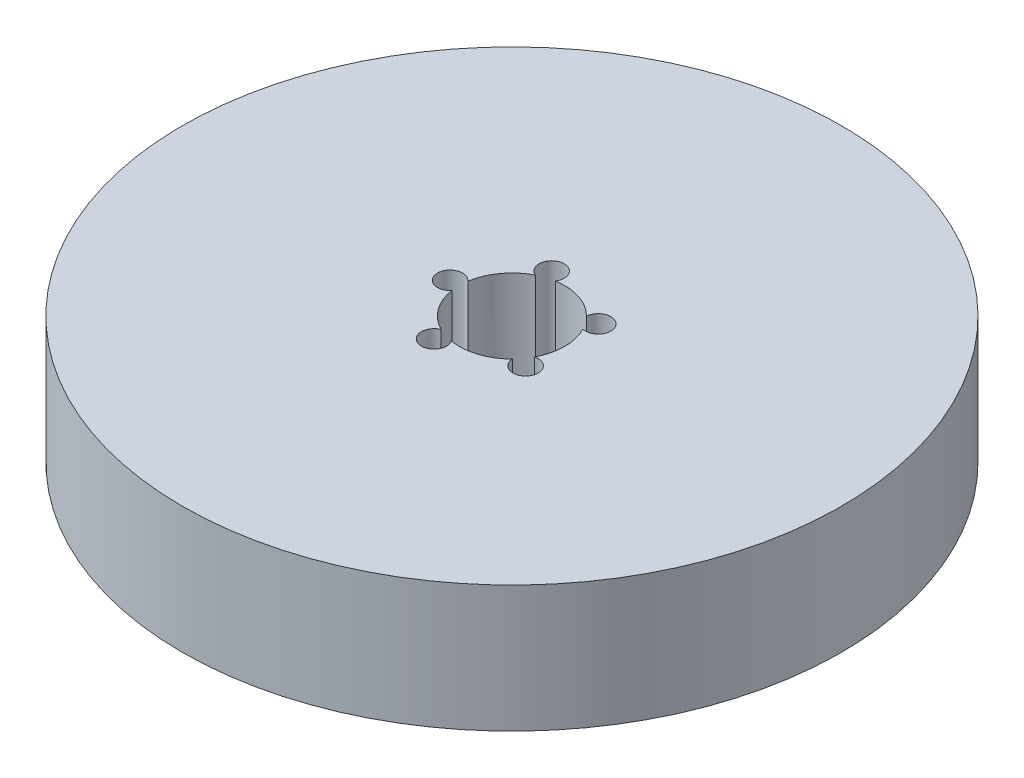
from build123d import *

# Parameters (mm, degrees)
SKETCH1_R           = 62.5
BOSS_EXTRUDE1_DEPTH = 24
SKETCH2_R           = 10
CUT_EXTRUDE1_DEPTH  = 92.588754768
SKETCH3_R           = 2.384291232
CUT_EXTRUDE2_DEPTH  = 23.873555075
CIRPATTERN1_COUNT   = 5


with BuildPart() as part:
    # Sketch1 → Boss-Extrude1 (new body)
    with BuildSketch(Plane(origin=(0, 0, 0), x_dir=(1, 0, 0), z_dir=(0, 1, 0))):
        Circle(SKETCH1_R)
    extrude(amount=BOSS_EXTRUDE1_DEPTH)

    # Sketch2 → Cut-Extrude1 (cut, through all)
    with BuildSketch(Plane(origin=(0, 0, 0), x_dir=(1, 0, 0), z_dir=(0, 1, 0))):
        Circle(SKETCH2_R)
    extrude(amount=CUT_EXTRUDE1_DEPTH, mode=Mode.SUBTRACT)

    # Sketch3 → Cut-Extrude2 (cut)
    with BuildSketch(Plane(origin=(0, 24, 0), x_dir=(1, 0, 0), z_dir=(0, 1, 0))):
        with Locations((-11.723740212, 0)):
            Circle(SKETCH3_R)
    cut_extrude2 = extrude(amount=-CUT_EXTRUDE2_DEPTH, mode=Mode.SUBTRACT)

    # CirPattern1: Cut-Extrude2 ×5 about axis
    cirpattern1_axis = Axis((0, 0, 0), (0, 1, 0))
    for i in range(1, CIRPATTERN1_COUNT):
        add(cut_extrude2.rotate(cirpattern1_axis, i * 360 / CIRPATTERN1_COUNT), mode=Mode.SUBTRACT)


solid = part.part
